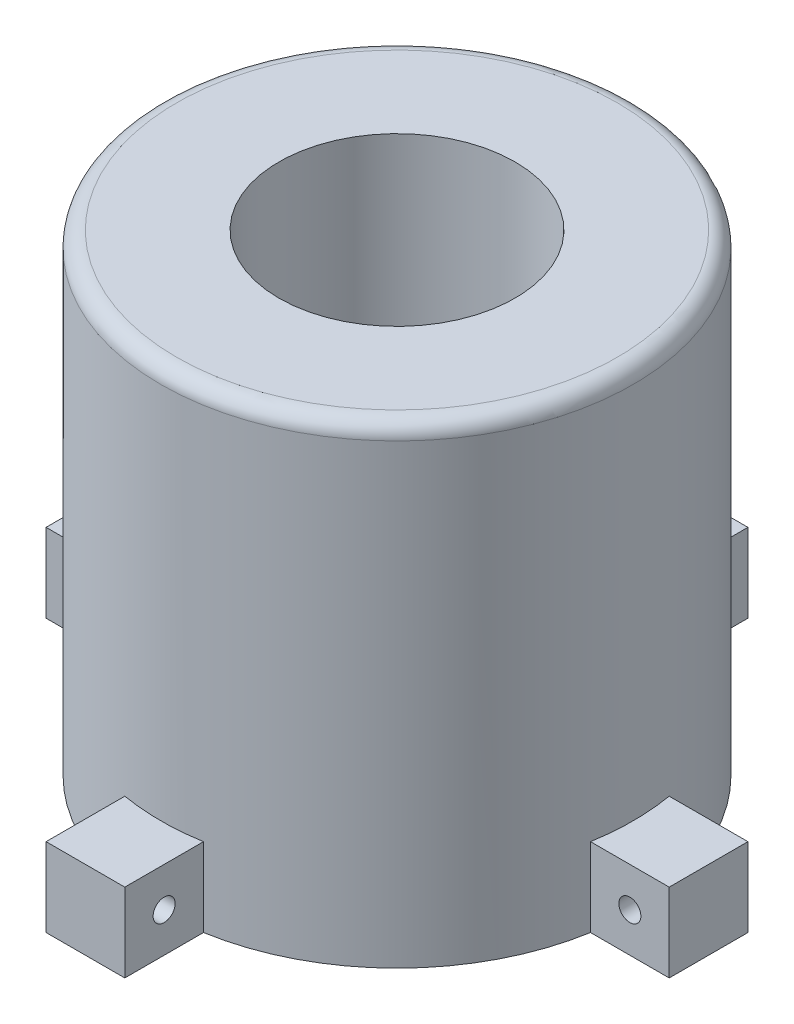
from build123d import *

# Parameters (mm, degrees)
SKETCH2_R           = 38.1
BOSS_EXTRUDE1_DEPTH = 76.2
SKETCH3_R           = 19.05
CUT_EXTRUDE1_DEPTH  = 76.2
FILLET1_R           = 2.54
BOSS_EXTRUDE2_DEPTH = 12.7
SKETCH5_R           = 1.778
CUT_EXTRUDE2_DEPTH  = 25.4
CIRPATTERN2_COUNT   = 4


with BuildPart() as part:
    # Sketch2 → Boss-Extrude1 (new body)
    with BuildSketch(Plane(origin=(0, 0, 0), x_dir=(1, 0, 0), z_dir=(0, 1, 0))):
        Circle(SKETCH2_R)
    extrude(amount=BOSS_EXTRUDE1_DEPTH)

    # Sketch3 → Cut-Extrude1 (cut)
    with BuildSketch(Plane(origin=(0, 76.2, 0), x_dir=(1, 0, 0), z_dir=(0, 1, 0))):
        Circle(SKETCH3_R)
    extrude(amount=-CUT_EXTRUDE1_DEPTH, mode=Mode.SUBTRACT)

    # Fillet1
    fillet1_edges = [part.edges().sort_by_distance(p)[0] for p in [
        (-38.1, 76.2, 0),
    ]]
    fillet(fillet1_edges, radius=FILLET1_R)

    # Sketch4 → Boss-Extrude2 (add)
    with BuildSketch(Plane(origin=(0, 0, 0), x_dir=(1, 0, 0), z_dir=(0, 1, 0))):
        with BuildLine():
            Line((-37.567106623, 6.35), (-50.267106623, 6.35))
            Line((-50.267106623, 6.35), (-50.267106623, -6.35))
            Line((-50.267106623, -6.35), (-37.567106623, -6.35))
            ThreePointArc((-37.567106623, -6.35), (-38.1, 0), (-37.567106623, 6.35))
        make_face()
    boss_extrude2 = extrude(amount=BOSS_EXTRUDE2_DEPTH)

    # Sketch5 → Cut-Extrude2 (cut)
    with BuildSketch(Plane.XY.offset(6.35)):
        with Locations((-43.917106623, 6.35)):
            Circle(SKETCH5_R)
    cut_extrude2 = extrude(amount=-CUT_EXTRUDE2_DEPTH, mode=Mode.SUBTRACT)

    # CirPattern2: Boss-Extrude2, Cut-Extrude2 ×4 about axis
    cirpattern2_axis = Axis((0, 76.2, 0), (0, -1, 0))
    add([boss_extrude2.rotate(cirpattern2_axis, i * 360 / CIRPATTERN2_COUNT) for i in range(1, CIRPATTERN2_COUNT)])
    add([cut_extrude2.rotate(cirpattern2_axis, i * 360 / CIRPATTERN2_COUNT) for i in range(1, CIRPATTERN2_COUNT)], mode=Mode.SUBTRACT)


solid = part.part
